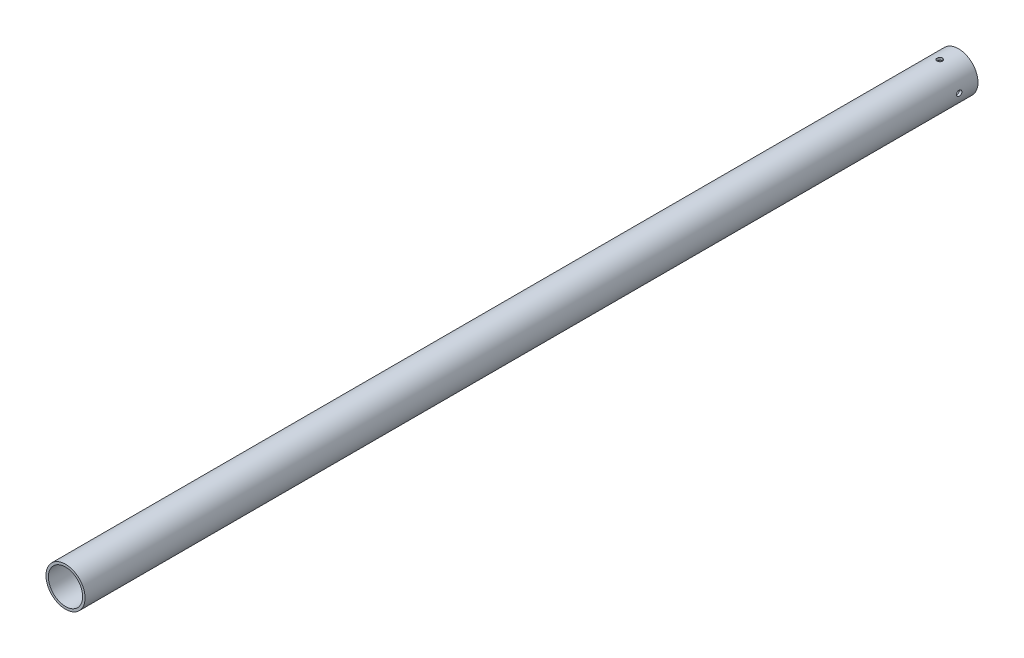
from build123d import *

# Parameters (mm, degrees)
SKETCH2_R               = 12.7
SKETCH2_R_2             = 11.1125
BOSS_EXTRUDE1_DEPTH     = 289.912399981
CUT_EXTRUDE1_DEPTH      = 291.468207663
CUT_EXTRUDE1_DEPTH_BACK = 291.468207663
SKETCH3_R               = 1.7526
CUT_EXTRUDE2_DEPTH      = 291.468207772
CUT_EXTRUDE2_DEPTH_BACK = 291.468207772
SKETCH5_R               = 1.7526


with BuildPart() as part:
    # Sketch2 → Boss-Extrude1 (new, symmetric)
    with BuildSketch(Plane.XY):
        Circle(SKETCH2_R)
        Circle(SKETCH2_R_2, mode=Mode.SUBTRACT)
    extrude(amount=BOSS_EXTRUDE1_DEPTH, both=True)

    # Sketch3 → Cut-Extrude1 (cut, two sides: drawn at the far end of the back side and taken through both)
    with BuildSketch(Plane(origin=(0, 0, 0), x_dir=(1, 0, 0), z_dir=(0, 1, 0)).offset(-CUT_EXTRUDE1_DEPTH_BACK)):
        with Locations((0, 277.720399981)):
            Circle(SKETCH3_R)
    extrude(amount=CUT_EXTRUDE1_DEPTH + CUT_EXTRUDE1_DEPTH_BACK, mode=Mode.SUBTRACT)

    # Sketch5 → Cut-Extrude2 (cut, two sides: drawn at the far end of the back side and taken through both)
    with BuildSketch(Plane(origin=(0, 0, 0), x_dir=(0, 0, -1), z_dir=(1, 0, 0)).offset(-CUT_EXTRUDE2_DEPTH_BACK)):
        with Locations((277.720399981, 0)):
            Circle(SKETCH5_R)
    extrude(amount=CUT_EXTRUDE2_DEPTH + CUT_EXTRUDE2_DEPTH_BACK, mode=Mode.SUBTRACT)


solid = part.part
